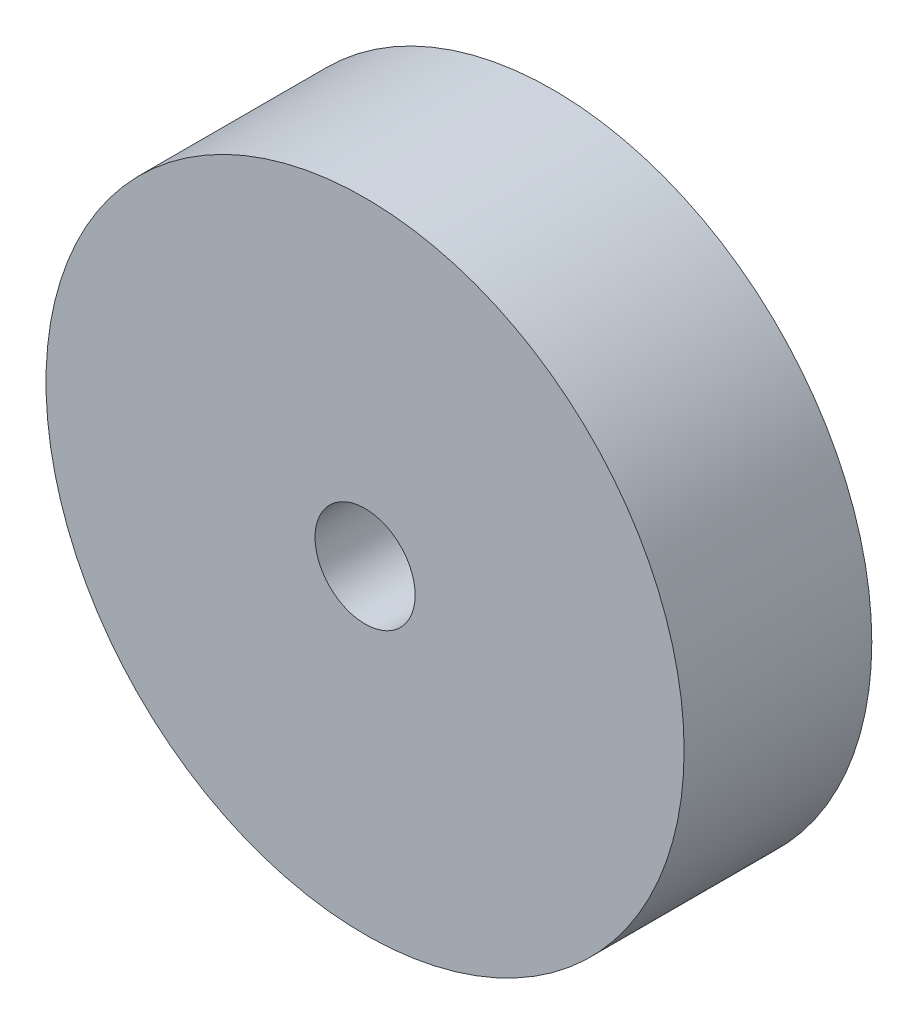
from build123d import *

# Parameters (mm, degrees)
SKETCH1_R           = 25.5
SKETCH1_R_2         = 4
BOSS_EXTRUDE1_DEPTH = 15


with BuildPart() as part:
    # Sketch1 → Boss-Extrude1 (new body)
    with BuildSketch(Plane.XY):
        Circle(SKETCH1_R)
        Circle(SKETCH1_R_2, mode=Mode.SUBTRACT)
    extrude(amount=BOSS_EXTRUDE1_DEPTH)


solid = part.part
